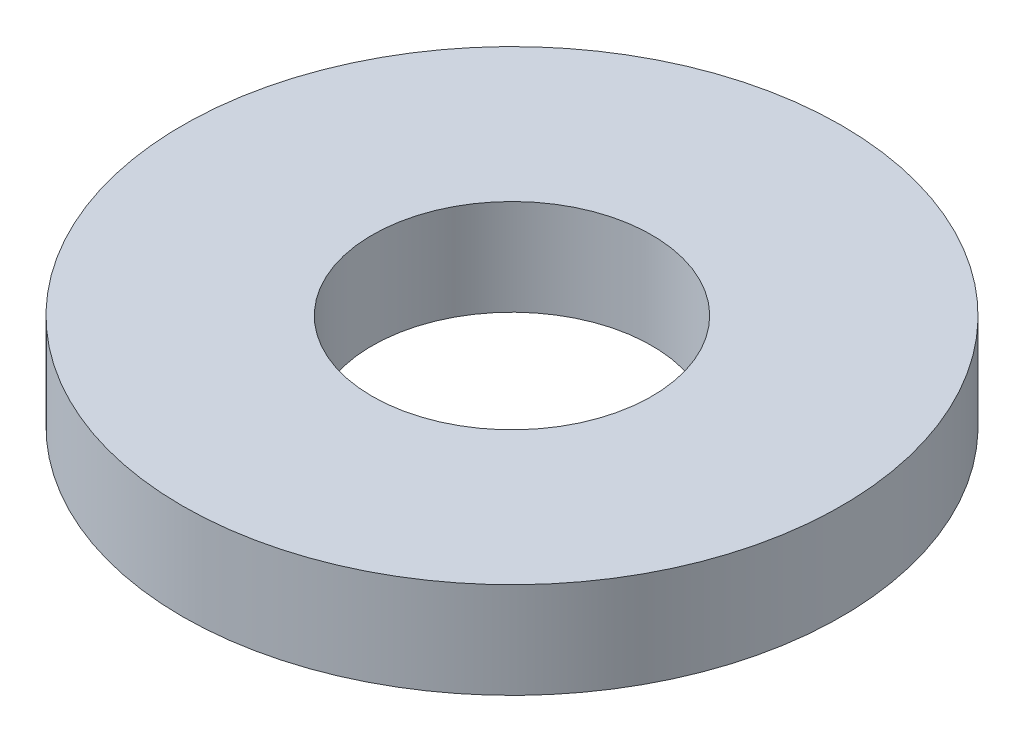
from build123d import *

# Parameters (mm, degrees)
SKETCH1_R           = 82.5
BOSS_EXTRUDE1_DEPTH = 24
SKETCH2_R           = 35
CUT_EXTRUDE1_DEPTH  = 120.115490177


with BuildPart() as part:
    # Sketch1 → Boss-Extrude1 (new body)
    with BuildSketch(Plane(origin=(0, 0, 0), x_dir=(1, 0, 0), z_dir=(0, 1, 0))):
        Circle(SKETCH1_R)
    extrude(amount=BOSS_EXTRUDE1_DEPTH)

    # Sketch2 → Cut-Extrude1 (cut, through all)
    with BuildSketch(Plane(origin=(0, 0, 0), x_dir=(1, 0, 0), z_dir=(0, 1, 0))):
        Circle(SKETCH2_R)
    extrude(amount=CUT_EXTRUDE1_DEPTH, mode=Mode.SUBTRACT)


solid = part.part
